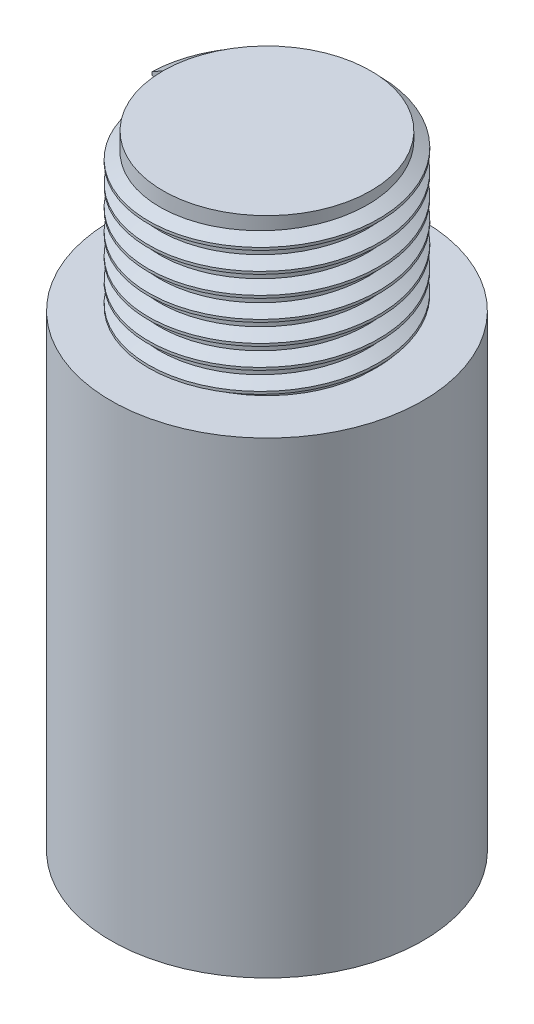
from build123d import *

# Parameters (mm, degrees)
THREAD1_PITCH = 1.27


with BuildPart() as part:
    # Sketch1 → Revolve1 (revolve)
    with BuildSketch(Plane.XY, mode=Mode.PRIVATE) as revolve1_sk:
        Polygon((0, 0), (9.525, 0), (9.525, 28.575), (6.35, 28.575), (6.35, 38.1), (0, 38.1), align=None)
    revolve(revolve1_sk.sketch.rotate(Axis((0, 0, 0), (0, 1, 0)), 90), axis=Axis((0, 0, 0), (0, 1, 0)))

    # Thread1: the profile of Thread Profile2 profile screwed along a right-hand helix of 7.874016 turns, 8 arcs to a turn; built about Z, then put on its axis
    thread1_z = Axis((0, 0, 0), (0, 0, 1))
    thread1_corners = [(6.3497, 0, -0.000173205), (7.037407661, 0, 0.396874998), (7.037407661, 0, 0.555624998), (6.3497, 0, 0.952673202)]
    with BuildLine(mode=Mode.PRIVATE) as thread1_profile:
        Line(thread1_corners[0], thread1_corners[1])
        Line(thread1_corners[1], thread1_corners[2])
        Line(thread1_corners[2], thread1_corners[3])
        Line(thread1_corners[3], thread1_corners[0])
    thread1_cap = Face(thread1_profile.wire())
    thread1_turn_angles = [0, 22.5, 45, 67.5, 90, 112.5, 135, 157.5, 180, 202.5, 225, 247.5, 270, 292.5, 315, 337.5, 360]
    thread1_turn_weights = [1, 0.9238795325112867, 1, 0.9238795325112867, 1, 0.9238795325112867, 1, 0.9238795325112867, 1, 0.9238795325112867, 1, 0.9238795325112867, 1, 0.9238795325112867, 1, 0.9238795325112867, 1]
    thread1_turn_rails = [Edge.make_bspline([Vector(p[0], p[1], 0).rotate(thread1_z, thread1_turn_angles[k]) / thread1_turn_weights[k] + Vector(0, 0, p[2] + THREAD1_PITCH * thread1_turn_angles[k] / 360) for k in range(17)], [0, 0, 0, 1, 1, 2, 2, 3, 3, 4, 4, 5, 5, 6, 6, 7, 7, 8, 8, 8], 2, thread1_turn_weights) for p in thread1_corners]
    thread1_turn_sides = [Face.make_surface_from_curves(thread1_turn_rails[p[0]], thread1_turn_rails[p[1]]) for p in [(0, 1), (1, 2), (2, 3), (3, 0)]]
    thread1_last_angles = [2520, 2542.5, 2565, 2587.5, 2610, 2632.5, 2655, 2677.5, 2700, 2722.5, 2745, 2767.5, 2790, 2812.322834646, 2834.645669291]
    thread1_last_weights = [1, 0.9238795325112867, 1, 0.9238795325112867, 1, 0.9238795325112867, 1, 0.9238795325112867, 1, 0.9238795325112867, 1, 0.9238795325112867, 1, 0.9250584165493104, 1]
    thread1_last_rails = [Edge.make_bspline([Vector(p[0], p[1], 0).rotate(thread1_z, thread1_last_angles[k]) / thread1_last_weights[k] + Vector(0, 0, p[2] + THREAD1_PITCH * thread1_last_angles[k] / 360) for k in range(15)], [0, 0, 0, 1, 1, 2, 2, 3, 3, 4, 4, 5, 5, 6, 6, 7, 7, 7], 2, thread1_last_weights) for p in thread1_corners]
    thread1_last_sides = [Face.make_surface_from_curves(thread1_last_rails[p[0]], thread1_last_rails[p[1]]) for p in [(0, 1), (1, 2), (2, 3), (3, 0)]]
    thread1 = Plane(origin=(0, 38.1, 0), x_dir=(-1, 0, 0), z_dir=(0, -1, 0)) * Solid(Shell([*[p.moved(Location((0, 0, THREAD1_PITCH * i))) for i in range(7) for p in thread1_turn_sides], *thread1_last_sides, thread1_cap, thread1_cap.rotate(thread1_z, 2834.645669291).moved(Location((0, 0, THREAD1_PITCH * 2834.645669291 / 360)))]))
    add(thread1)


solid = part.part
